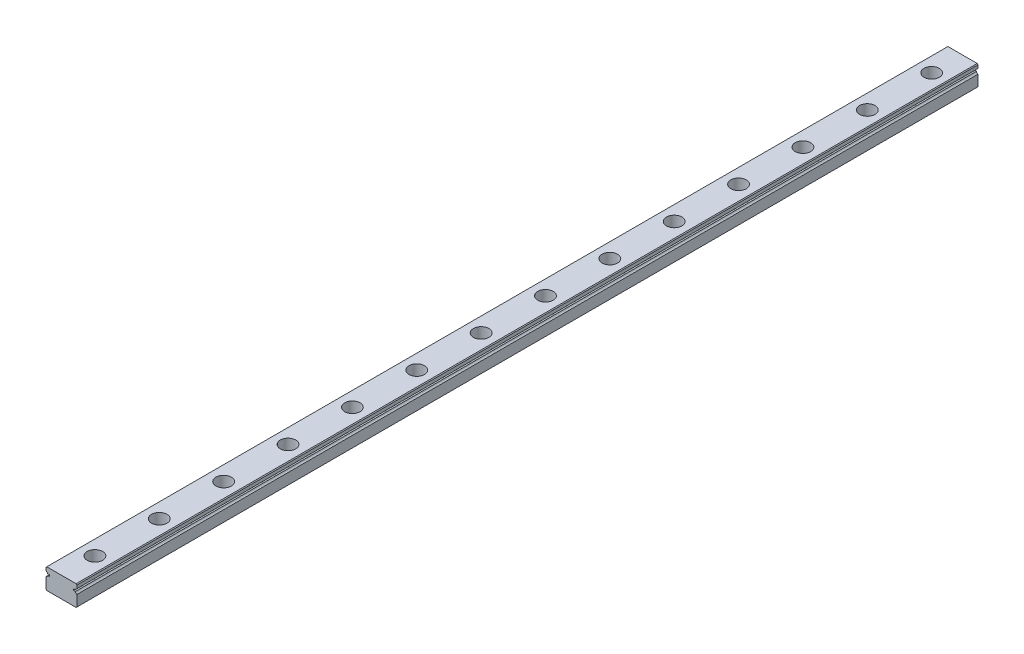
from build123d import *

# Parameters (mm, degrees)
EXTRUDE_1_DEPTH        = 350
SKETCH_2_R             = 3
SKETCH_2_R_2           = 1.75
CUT_EXTRUDE_1_DEPTH    = 4.5
SKETCH_2_2_R           = 1.75
CUT_EXTRUDE_2_DEPTH    = 351.142828
PATTERN_LINEAR_1_COUNT = 16
PATTERN_LINEAR_1_PITCH = 25


with BuildPart() as part:
    # Эскиз1 → Бобышка-Вытянуть1 (new body)
    with BuildSketch(Plane.XY):
        with BuildLine():
            Line((-6, 3.7), (-5.7, 4))
            Line((-5.7, 4), (5.7, 4))
            Line((5.7, 4), (6, 3.7))
            Line((6, 3.7), (6, 2.451013544))
            ThreePointArc((6, 2.451013544), (5.597935912, 2.202976267), (5.354599002, 1.798050138))
            Line((5.354599002, 1.798050138), (4.643514056, 1.798050138))
            Line((4.643514056, 1.798050138), (4.643514056, 1.201949862))
            Line((4.643514056, 1.201949862), (5.354599002, 1.201949862))
            ThreePointArc((5.354599002, 1.201949862), (5.597935912, 0.797023733), (6, 0.548986456))
            Line((6, 0.548986456), (6, -3.7))
            Line((6, -3.7), (5.7, -4))
            Line((5.7, -4), (-5.7, -4))
            Line((-5.7, -4), (-6, -3.7))
            Line((-6, -3.7), (-6, 0.548986456))
            ThreePointArc((-6, 0.548986456), (-5.597935912, 0.797023733), (-5.354599002, 1.201949862))
            Line((-5.354599002, 1.201949862), (-4.643514056, 1.201949862))
            Line((-4.643514056, 1.201949862), (-4.643514056, 1.798050138))
            Line((-4.643514056, 1.798050138), (-5.354599002, 1.798050138))
            ThreePointArc((-5.354599002, 1.798050138), (-5.597935912, 2.202976267), (-6, 2.451013544))
            Line((-6, 2.451013544), (-6, 3.7))
        make_face()
    extrude(amount=EXTRUDE_1_DEPTH)

    # Эскиз2 → Вырез-Вытянуть1 (cut)
    with BuildSketch(Plane(origin=(0, 4, 0), x_dir=(1, 0, 0), z_dir=(0, 1, 0))):
        with Locations((0, -12)):
            Circle(SKETCH_2_R)
        with Locations((0, -12)):
            Circle(SKETCH_2_R_2, mode=Mode.SUBTRACT)
    cut_extrude_1 = extrude(amount=-CUT_EXTRUDE_1_DEPTH, mode=Mode.SUBTRACT)

    # Эскиз2<2> → Вырез-Вытянуть2 (cut, through all)
    with BuildSketch(Plane(origin=(0, 4, 0), x_dir=(1, 0, 0), z_dir=(0, 1, 0))):
        with Locations((0, -12)):
            Circle(SKETCH_2_2_R)
    cut_extrude_2 = extrude(amount=-CUT_EXTRUDE_2_DEPTH, mode=Mode.SUBTRACT)

    # Линейный массив1: Вырез-Вытянуть1, Вырез-Вытянуть2 ×16
    with Locations(*[(0, 0, i * PATTERN_LINEAR_1_PITCH) for i in range(1, PATTERN_LINEAR_1_COUNT)]):
        add(cut_extrude_1, mode=Mode.SUBTRACT)
        add(cut_extrude_2, mode=Mode.SUBTRACT)


solid = part.part
